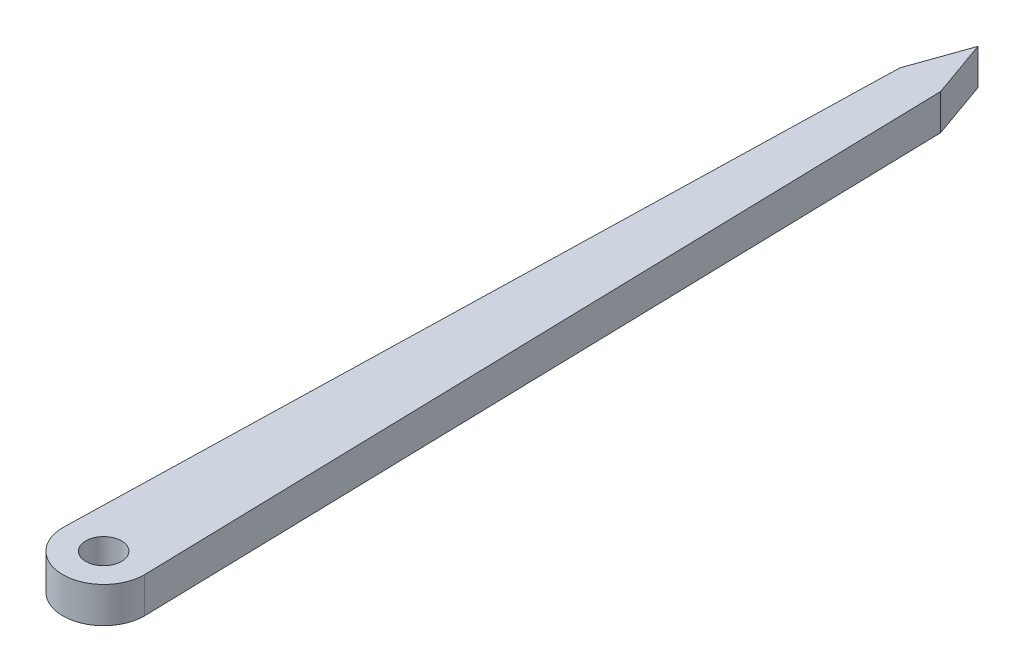
from build123d import *

# Parameters (mm, degrees)
SKICA1_R                = 1.75
P_IDAT_VYSUNUT_M1_DEPTH = 3.5


with BuildPart() as part:
    # Skica1 → Přidat vysunutím1 (new body)
    with BuildSketch(Plane(origin=(0, 0, 0), x_dir=(1, 0, 0), z_dir=(0, 1, 0))):
        with BuildLine():
            ThreePointArc((-4, 0), (0, -4), (4, 0))
            Line((4, 0), (2, 80))
            Line((2, 80), (0, 85.656854249))
            Line((0, 85.656854249), (-2, 80))
            Line((-2, 80), (-4, 0))
        make_face()
        Circle(SKICA1_R, mode=Mode.SUBTRACT)
    extrude(amount=P_IDAT_VYSUNUT_M1_DEPTH)


solid = part.part
